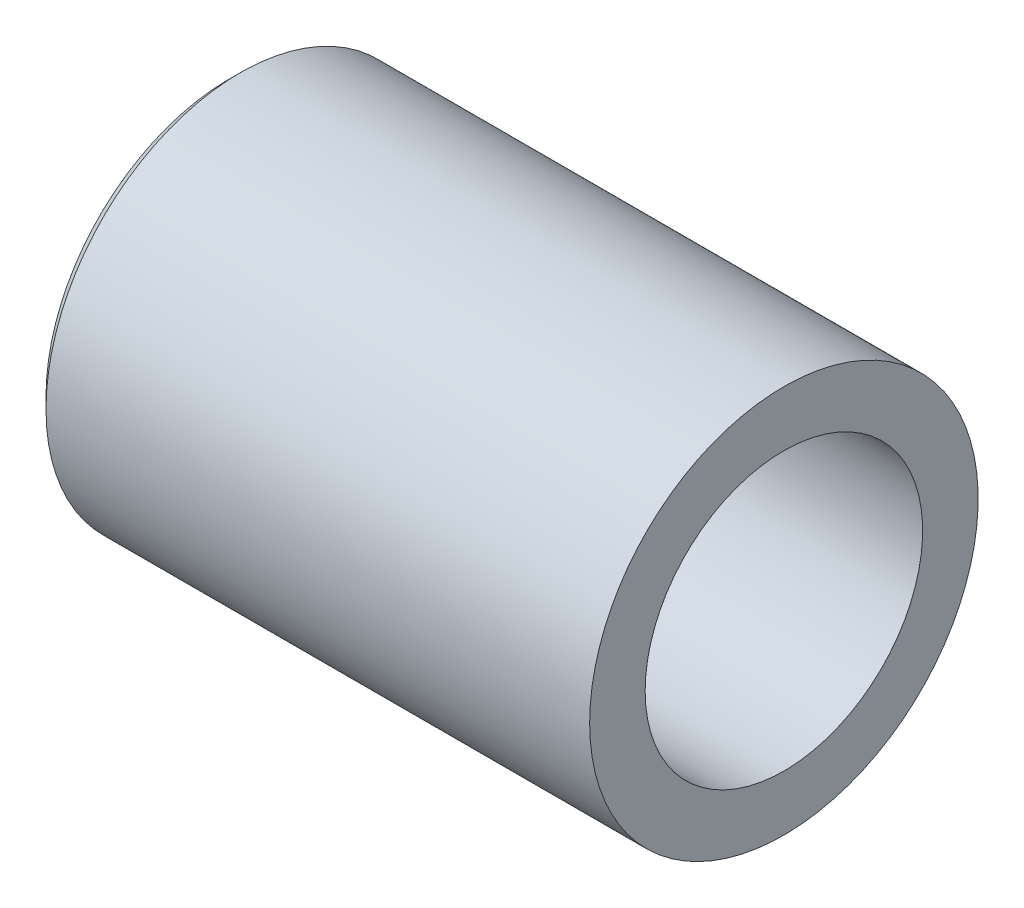
from build123d import *


with BuildPart() as part:
    # Sketch1 → Revolve1 (revolve)
    with BuildSketch(Plane.XY):
        Polygon((7.47625, 5.55625), (23.02660616, 5.55625), (23.02660616, 3.96875), (7.15875, 3.96875), (7.15875, 5.23875), align=None)
    revolve(axis=Axis((0, 0, 0), (1, 0, 0)))


solid = part.part
